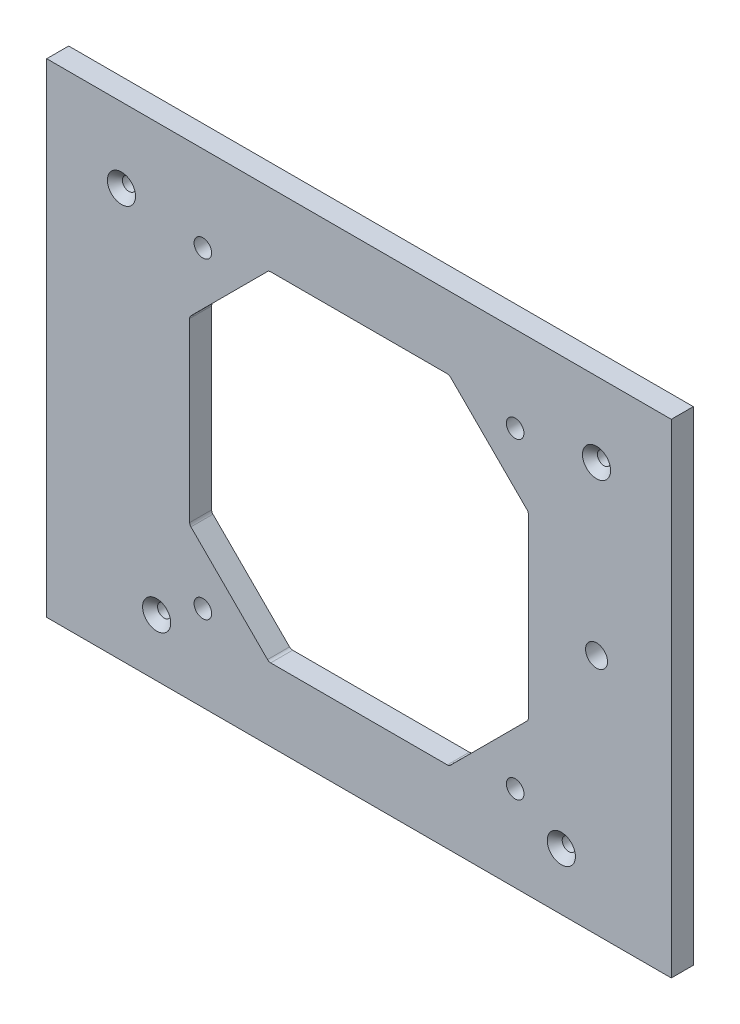
from build123d import *

# Parameters (mm, degrees)
SKETCH1_W           = 142
SKETCH1_H           = 110
BOSS_EXTRUDE1_DEPTH = 2.5
SKETCH3_R           = 1.5
TOPCOVERHOLES_DEPTH = 90.949986103
SKETCH5_R           = 1.5
CUT_EXTRUDE1_DEPTH  = 90.949986103
CHAMFER1_SIZE       = 1.7
SKETCH7_R           = 2
FAN_DEPTH           = 90.949986103
SKETCH8_R           = 2.5
FORLED_DEPTH        = 90.949986103
FILLET1_R           = 1


with BuildPart() as part:
    # Sketch1 → Boss-Extrude1 (new, symmetric)
    with BuildSketch(Plane.XY):
        Rectangle(SKETCH1_W, SKETCH1_H)
    extrude(amount=BOSS_EXTRUDE1_DEPTH, both=True)

    # Sketch3 → TopCoverHoles (cut, through all)
    with BuildSketch(Plane.XY.offset(2.5)):
        with Locations((-54, 38)):
            Circle(SKETCH3_R)
        with Locations((54, 38)):
            Circle(SKETCH3_R)
    extrude(amount=-TOPCOVERHOLES_DEPTH, mode=Mode.SUBTRACT)

    # Sketch5 → Cut-Extrude1 (cut, through all)
    with BuildSketch(Plane.XY.offset(2.5)):
        with Locations((46, -42)):
            Circle(SKETCH5_R)
        with Locations((-46, -42)):
            Circle(SKETCH5_R)
    extrude(amount=-CUT_EXTRUDE1_DEPTH, mode=Mode.SUBTRACT)

    # Chamfer1
    chamfer1_edges = [part.edges().sort_by_distance(p)[0] for p in [
        (52.5, 38, 2.5),
        (-55.5, 38, 2.5),
        (44.5, -42, 2.5),
        (-47.5, -42, 2.5),
    ]]
    chamfer(chamfer1_edges, length=CHAMFER1_SIZE)

    # Sketch7 → Fan (cut, through all)
    with BuildSketch(Plane.XY.offset(2.5)):
        with Locations((-35.5, -35.5)):
            Circle(SKETCH7_R)
        with Locations((35.5, -35.5)):
            Circle(SKETCH7_R)
        with Locations((35.5, 35.5)):
            Circle(SKETCH7_R)
        with Locations((-35.5, 35.5)):
            Circle(SKETCH7_R)
        Polygon((-20.5, 38.5), (-38.5, 20.5), (-38.5, -20.5), (-20.5, -38.5), (20.5, -38.5), (38.5, -20.5), (38.5, 20.5), (20.5, 38.5), align=None)
    extrude(amount=-FAN_DEPTH, mode=Mode.SUBTRACT)

    # Sketch8 → ForLED (cut, through all)
    with BuildSketch(Plane.XY.offset(2.5)):
        with Locations((54, 0)):
            Circle(SKETCH8_R)
    extrude(amount=-FORLED_DEPTH, mode=Mode.SUBTRACT)

    # Fillet1
    fillet1_edges = [part.edges().sort_by_distance(p)[0] for p in [
        (38.5, 20.5, 0),
        (38.5, -20.5, 0),
        (20.5, -38.5, 0),
        (-38.5, -20.5, 0),
        (-38.5, 20.5, 0),
        (-20.5, 38.5, 0),
        (20.5, 38.5, 0),
        (-20.5, -38.5, 0),
    ]]
    fillet(fillet1_edges, radius=FILLET1_R)


solid = part.part
